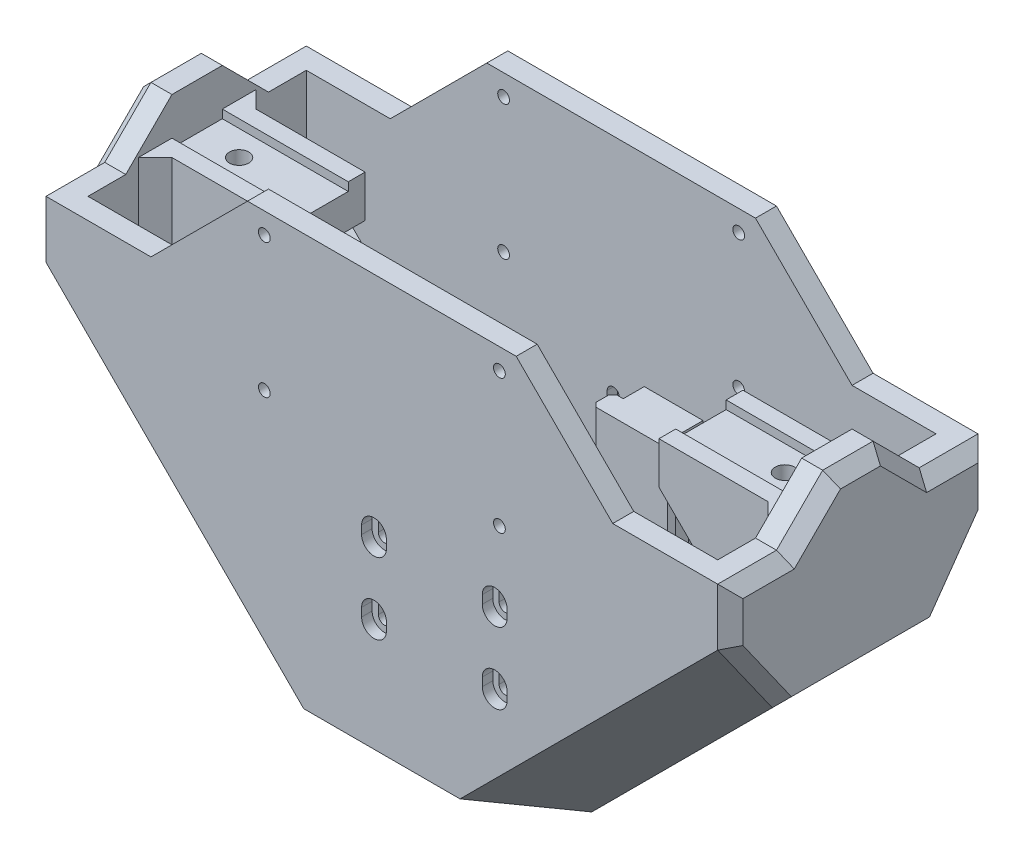
from build123d import *

# Parameters (mm, degrees)
SKETCH1_W                  = 150
SKETCH1_H                  = 52
BOSS_EXTRUDE1_DEPTH        = 70
SHELL1_T                   = 5
BOSS_EXTRUDE2_DEPTH        = 5
BOSS_EXTRUDE3_DEPTH        = 5
SKETCH3_R                  = 1.4
CUT_EXTRUDE1_DEPTH         = 6
BOSS_EXTRUDE4_DEPTH        = 10
SKETCH9_W                  = 30
SKETCH9_H                  = 20
BOSS_EXTRUDE6_DEPTH        = 2
CUT_EXTRUDE2_REACH         = 185.398
SKETCH10_W                 = 12
SKETCH10_H                 = 2
SKETCH11_R                 = 2.3
CUT_EXTRUDE3_DEPTH         = 6
CHAMFER3_SIZE              = 40
CHAMFER5_SIZE              = 43
CHAMFER11_SIZE             = 10
CHAMFER12_SIZE             = 13
CHAMFER13_SIZE             = 4
BOSS_EXTRUDE10_DEPTH       = 3
CHAMFER14_SIZE             = 3
CHAMFER14_OF_MIRROR28_SIZE = 3
SKETCH17_W                 = 14
SKETCH17_H                 = 5
BOSS_EXTRUDE11_DEPTH       = 45
SKETCH20_W                 = 19
SKETCH20_H                 = 5
BOSS_EXTRUDE14_DEPTH       = 8
CUT_EXTRUDE4_DEPTH         = 2.5
CUT_EXTRUDE5_REACH         = 140.124
CUT_EXTRUDE6_REACH         = 154.55
SKETCH24_W                 = 15
SKETCH24_H                 = 8
CHAMFER18_SIZE             = 4
CHAMFER19_SIZE             = 1
CHAMFER20_SIZE             = 2


# Some blends are built 0.0001 mm under size
with BuildPart() as part:
    # Sketch1 → Boss-Extrude1 (new body)
    with BuildSketch(Plane(origin=(0, 0, 0), x_dir=(1, 0, 0), z_dir=(0, 1, 0))):
        Rectangle(SKETCH1_W, SKETCH1_H)
    extrude(amount=BOSS_EXTRUDE1_DEPTH)

    # Shell1
    shell1_openings = [part.faces().sort_by_distance(p)[0] for p in [
        (0, 70, 0),
    ]]
    offset(amount=SHELL1_T, openings=shell1_openings, kind=Kind.INTERSECTION)

    # Sketch2 → Boss-Extrude2 (add)
    with BuildSketch(Plane(origin=(80, 0, 0), x_dir=(0, 0, -1), z_dir=(1, 0, 0))):
        Polygon((-17, 70), (-6, 81), (6, 81), (17, 70), align=None)
    boss_extrude2 = extrude(amount=-BOSS_EXTRUDE2_DEPTH)

    # Sketch4 → Boss-Extrude3 (add)
    with BuildSketch(Plane(origin=(0, 0, -31), x_dir=(-1, 0, 0), z_dir=(0, 0, -1))):
        Polygon((-55, 70), (-32, 93), (32, 93), (55, 70), align=None)
    boss_extrude3 = extrude(amount=-BOSS_EXTRUDE3_DEPTH)

    # Sketch3 → Cut-Extrude1 (cut)
    with BuildSketch(Plane(origin=(0, 0, -31), x_dir=(-1, 0, 0), z_dir=(0, 0, -1))):
        with Locations((-28, 88)):
            Circle(SKETCH3_R)
        with Locations((-28, 56)):
            Circle(SKETCH3_R)
        with Locations((28, 88)):
            Circle(SKETCH3_R)
        with Locations((28, 56)):
            Circle(SKETCH3_R)
    cut_extrude1 = extrude(amount=-CUT_EXTRUDE1_DEPTH, mode=Mode.SUBTRACT)

    # Mirror4: Boss-Extrude3, Cut-Extrude1 across plane
    add(boss_extrude3.mirror(Plane.XY))
    add(cut_extrude1.mirror(Plane.XY), mode=Mode.SUBTRACT)

    # Mirror5: Boss-Extrude2 across plane
    add(boss_extrude2.mirror(Plane(origin=(0, 0, 0), x_dir=(0, 0, 1), z_dir=(1, 0, 0))))

    # Sketch5 → Boss-Extrude4 (add, symmetric)
    with BuildSketch(Plane.XY):
        Polygon((-75, 70), (-45, 70), (-45, 62), (-75, 32), align=None)
    boss_extrude4 = extrude(amount=BOSS_EXTRUDE4_DEPTH, both=True)

    # Sketch9 → Boss-Extrude6 (add)
    with BuildSketch(Plane(origin=(0, 70, 0), x_dir=(1, 0, 0), z_dir=(0, 1, 0))):
        with Locations((-60, 0)):
            Rectangle(SKETCH9_W, SKETCH9_H)
    boss_extrude6 = extrude(amount=BOSS_EXTRUDE6_DEPTH)

    # Sketch10 → Cut-Extrude2 (cut, up to next)
    with BuildSketch(Plane(origin=(-75, 0, 0), x_dir=(0, 0, -1), z_dir=(1, 0, 0)), mode=Mode.PRIVATE) as cut_extrude2_sk1:
        with Locations((0, 71)):
            Rectangle(SKETCH10_W, SKETCH10_H)
    cut_extrude2_tool1 = extrude(cut_extrude2_sk1.sketch, amount=CUT_EXTRUDE2_REACH, mode=Mode.PRIVATE) & part.part
    cut_extrude2 = cut_extrude2_tool1.solids().sort_by_distance((-75, 71, 0))[0]
    add(cut_extrude2, mode=Mode.SUBTRACT)

    # Sketch11 → Cut-Extrude3 (cut)
    with BuildSketch(Plane(origin=(0, 70, 0), x_dir=(1, 0, 0), z_dir=(0, 1, 0))):
        with Locations(Location((-65, 0, 0), (0, 0, 270))):
            Circle(SKETCH11_R)
    cut_extrude3 = extrude(amount=-CUT_EXTRUDE3_DEPTH, mode=Mode.SUBTRACT)

    # Mirror24: Boss-Extrude4, Boss-Extrude6, Cut-Extrude2, Cut-Extrude3 across plane
    add(boss_extrude4.mirror(Plane(origin=(0, 0, 0), x_dir=(0, 0, 1), z_dir=(1, 0, 0))))
    add(boss_extrude6.mirror(Plane(origin=(0, 0, 0), x_dir=(0, 0, 1), z_dir=(1, 0, 0))))
    add(cut_extrude2.mirror(Plane(origin=(0, 0, 0), x_dir=(0, 0, 1), z_dir=(1, 0, 0))), mode=Mode.SUBTRACT)
    add(cut_extrude3.mirror(Plane(origin=(0, 0, 0), x_dir=(0, 0, 1), z_dir=(1, 0, 0))), mode=Mode.SUBTRACT)

    # Chamfer3
    # the kernel refuses this chamfer: 40 mm, written as the material it adds along each edge
    with BuildSketch(Plane(origin=(75, 0, 26), x_dir=(-0.9996219169112968, -0.027495876610586372, 0), z_dir=(0, 0, -1))) as chamfer3_piece_1:
        Polygon((CHAMFER3_SIZE * 0.999621916911, CHAMFER3_SIZE * 0.0274958766106), (-CHAMFER3_SIZE * 0.0274958766106, CHAMFER3_SIZE * 0.999621916911), (0, 0), align=None)
    extrude(amount=52)
    with BuildSketch(Plane(origin=(-75, 0, -26), x_dir=(-0.027495876610586317, 0.9996219169112968, 0), z_dir=(0, 0, 1))) as chamfer3_piece_2:
        Polygon((CHAMFER3_SIZE * 0.999621916911, -CHAMFER3_SIZE * 0.0274958766106), (-CHAMFER3_SIZE * 0.0274958766106, -CHAMFER3_SIZE * 0.999621916911), (0, 0), align=None)
    extrude(amount=52)

    # Chamfer5
    chamfer5_edges = [part.edges().sort_by_distance(p)[0] for p in [
        (-80, -5, 0),
        (80, -5, 0),
    ]]
    chamfer(chamfer5_edges, length=CHAMFER5_SIZE)

    # Chamfer11
    chamfer11_edges = [part.edges().sort_by_distance(p)[0] for p in [
        (-55, 20, -26),
        (55, 20, -26),
        (-55, 20, 26),
        (55, 20, 26),
    ]]
    chamfer(chamfer11_edges, length=CHAMFER11_SIZE)

    # Chamfer12
    chamfer12_edges = [part.edges().sort_by_distance(p)[0] for p in [
        (-58.5, 16.5, -31),
        (58.5, 16.5, -31),
        (-58.5, 16.5, 31),
        (58.5, 16.5, 31),
    ]]
    chamfer(chamfer12_edges, length=CHAMFER12_SIZE)

    # Chamfer13
    chamfer13_edges = [part.edges().sort_by_distance(p)[0] for p in [
        (-75, 56, -10),
        (-75, 56, 10),
        (75, 56, 10),
        (75, 56, -10),
    ]]
    chamfer(chamfer13_edges, length=CHAMFER13_SIZE)

    # Sketch16 → Boss-Extrude10 (add)
    with BuildSketch(Plane(origin=(80, 0, 0), x_dir=(0, 0, -1), z_dir=(1, 0, 0))):
        Polygon((-18, 38), (18, 38), (31, 56.384776311), (31, 70), (17, 70), (6, 81), (-6, 81), (-17, 70), (-31, 70), (-31, 56.384776311), align=None)
    boss_extrude10 = extrude(amount=BOSS_EXTRUDE10_DEPTH)

    # Chamfer14
    chamfer14_edges = [part.edges().sort_by_distance(p)[0] for p in [
        (83, 63.192388155, 31),
        (83, 70, 24),
        (83, 75.5, 11.5),
        (83, 81, 0),
        (83, 75.5, -11.5),
        (83, 70, -24),
        (83, 63.192388155, -31),
        (83, 47.192388155, -24.5),
        (83, 38, 0),
        (83, 47.192388155, 24.5),
    ]]
    chamfer(chamfer14_edges, length=CHAMFER14_SIZE - 0.0001)  # a hair under: the kernel refuses the full size

    # Mirror28: Boss-Extrude10 across plane
    add(boss_extrude10.mirror(Plane(origin=(0, 0, 0), x_dir=(0, 0, 1), z_dir=(1, 0, 0))))

    # Chamfer14 of Mirror28
    chamfer14_of_mirror28_edges = [part.edges().sort_by_distance(p)[0] for p in [
        (-83, 63.192388155, 31),
        (-83, 70, 24),
        (-83, 75.5, 11.5),
        (-83, 81, 0),
        (-83, 75.5, -11.5),
        (-83, 70, -24),
        (-83, 63.192388155, -31),
        (-83, 47.192388155, -24.5),
        (-83, 38, 0),
        (-83, 47.192388155, 24.5),
    ]]
    chamfer(chamfer14_of_mirror28_edges, length=CHAMFER14_OF_MIRROR28_SIZE - 0.0001)  # a hair under: the kernel refuses the full size

    # Sketch17 → Boss-Extrude11 (add)
    with BuildSketch(Plane(origin=(0, 0, 0), x_dir=(1, 0, 0), z_dir=(0, 1, 0))):
        Polygon((3, -21), (5.5, -21), (19.5, -21), (22, -21), (22, -16), (3, -16), align=None)
        with Locations((12.5, -23.5)):
            Rectangle(SKETCH17_W, SKETCH17_H)
    boss_extrude11 = extrude(amount=BOSS_EXTRUDE11_DEPTH)

    # Sketch20 → Boss-Extrude14 (add)
    with BuildSketch(Plane(origin=(0, 0, 0), x_dir=(1, 0, 0), z_dir=(0, 1, 0))):
        with Locations((12.5, -13.5)):
            Rectangle(SKETCH20_W, SKETCH20_H)
    boss_extrude14 = extrude(amount=BOSS_EXTRUDE14_DEPTH)

    # Mirror29: Boss-Extrude11, Boss-Extrude14 across plane
    add(boss_extrude11.mirror(Plane.XY))
    add(boss_extrude14.mirror(Plane.XY))

    # Sketch22 → Cut-Extrude4 (cut)
    with BuildSketch(Plane.XY.offset(-26)):
        with BuildLine():
            Line((-3.325, 37.8), (-3.325, 39.8))
            ThreePointArc((-3.325, 39.8), (-1.875, 41.25), (-0.425, 39.8))
            Line((-0.425, 39.8), (-0.425, 37.8))
            ThreePointArc((-0.425, 37.8), (-1.875, 36.35), (-3.325, 37.8))
        make_face()
        with BuildLine():
            Line((28.325, 37.8), (28.325, 39.8))
            ThreePointArc((28.325, 39.8), (26.875, 41.25), (25.425, 39.8))
            Line((25.425, 39.8), (25.425, 37.8))
            ThreePointArc((25.425, 37.8), (26.875, 36.35), (28.325, 37.8))
        make_face()
        with BuildLine():
            Line((-3.325, 22.8), (-3.325, 20.8))
            ThreePointArc((-3.325, 20.8), (-1.875, 19.35), (-0.425, 20.8))
            Line((-0.425, 20.8), (-0.425, 22.8))
            ThreePointArc((-0.425, 22.8), (-1.875, 24.25), (-3.325, 22.8))
        make_face()
        with BuildLine():
            Line((28.325, 22.8), (28.325, 20.8))
            ThreePointArc((28.325, 20.8), (26.875, 19.35), (25.425, 20.8))
            Line((25.425, 20.8), (25.425, 22.8))
            ThreePointArc((25.425, 22.8), (26.875, 24.25), (28.325, 22.8))
        make_face()
    cut_extrude4 = extrude(amount=-CUT_EXTRUDE4_DEPTH, mode=Mode.SUBTRACT)

    # Sketch23 → Cut-Extrude5 (cut, up to next)
    with BuildSketch(Plane.XY.offset(-28.5), mode=Mode.PRIVATE) as cut_extrude5_sk1:
        with BuildLine():
            Line((29.825, 37.8), (29.825, 39.8))
            ThreePointArc((29.825, 39.8), (26.875, 42.75), (23.925, 39.8))
            Line((23.925, 39.8), (23.925, 37.8))
            ThreePointArc((23.925, 37.8), (26.875, 34.85), (29.825, 37.8))
        make_face()
    cut_extrude5_tool1 = extrude(cut_extrude5_sk1.sketch, amount=-CUT_EXTRUDE5_REACH, mode=Mode.PRIVATE) & part.part
    # Sketch23 → Cut-Extrude5 (cut, up to next)
    with BuildSketch(Plane.XY.offset(-28.5), mode=Mode.PRIVATE) as cut_extrude5_sk2:
        with BuildLine():
            Line((1.075, 37.8), (1.075, 39.8))
            ThreePointArc((1.075, 39.8), (-1.875, 42.75), (-4.825, 39.8))
            Line((-4.825, 39.8), (-4.825, 37.8))
            ThreePointArc((-4.825, 37.8), (-1.875, 34.85), (1.075, 37.8))
        make_face()
    cut_extrude5_tool2 = extrude(cut_extrude5_sk2.sketch, amount=-CUT_EXTRUDE5_REACH, mode=Mode.PRIVATE) & part.part
    # Sketch23 → Cut-Extrude5 (cut, up to next)
    with BuildSketch(Plane.XY.offset(-28.5), mode=Mode.PRIVATE) as cut_extrude5_sk3:
        with BuildLine():
            Line((-4.825, 22.8), (-4.825, 20.8))
            ThreePointArc((-4.825, 20.8), (-1.875, 17.85), (1.075, 20.8))
            Line((1.075, 20.8), (1.075, 22.8))
            ThreePointArc((1.075, 22.8), (-1.875, 25.75), (-4.825, 22.8))
        make_face()
    cut_extrude5_tool3 = extrude(cut_extrude5_sk3.sketch, amount=-CUT_EXTRUDE5_REACH, mode=Mode.PRIVATE) & part.part
    # Sketch23 → Cut-Extrude5 (cut, up to next)
    with BuildSketch(Plane.XY.offset(-28.5), mode=Mode.PRIVATE) as cut_extrude5_sk4:
        with BuildLine():
            Line((23.925, 22.8), (23.925, 20.8))
            ThreePointArc((23.925, 20.8), (26.875, 17.85), (29.825, 20.8))
            Line((29.825, 20.8), (29.825, 22.8))
            ThreePointArc((29.825, 22.8), (26.875, 25.75), (23.925, 22.8))
        make_face()
    cut_extrude5_tool4 = extrude(cut_extrude5_sk4.sketch, amount=-CUT_EXTRUDE5_REACH, mode=Mode.PRIVATE) & part.part
    cut_extrude5_1 = cut_extrude5_tool1.solids().sort_by_distance((26.875, 38.8, -28.5))[0]
    add(cut_extrude5_1, mode=Mode.SUBTRACT)
    cut_extrude5_2 = cut_extrude5_tool2.solids().sort_by_distance((-1.875, 38.8, -28.5))[0]
    add(cut_extrude5_2, mode=Mode.SUBTRACT)
    cut_extrude5_3 = cut_extrude5_tool3.solids().sort_by_distance((-1.875, 21.8, -28.5))[0]
    add(cut_extrude5_3, mode=Mode.SUBTRACT)
    cut_extrude5_4 = cut_extrude5_tool4.solids().sort_by_distance((26.875, 21.8, -28.5))[0]
    add(cut_extrude5_4, mode=Mode.SUBTRACT)
    cut_extrude5 = cut_extrude5_1 + cut_extrude5_2 + cut_extrude5_3 + cut_extrude5_4  # Cut-Extrude5 as one shape, for the pattern or mirror that repeats it

    # Mirror30: Cut-Extrude4, Cut-Extrude5 across plane
    add(cut_extrude4.mirror(Plane.XY), mode=Mode.SUBTRACT)
    add(cut_extrude5.mirror(Plane.XY), mode=Mode.SUBTRACT)

    # Sketch24 → Cut-Extrude6 (cut, up to next)
    with BuildSketch(Plane(origin=(17.5, -17.5, 0), x_dir=(0, 0, 1), z_dir=(-0.707106781186544, 0.7071067811865511, 0)), mode=Mode.PRIVATE) as cut_extrude6_sk1:
        with Locations((0, 33.748737342)):
            Rectangle(SKETCH24_W, SKETCH24_H)
    cut_extrude6_tool1 = extrude(cut_extrude6_sk1.sketch, amount=-CUT_EXTRUDE6_REACH, mode=Mode.PRIVATE) & part.part
    add(cut_extrude6_tool1.solids().sort_by_distance((41.363961, 6.363961, 0))[0], mode=Mode.SUBTRACT)

    # Chamfer18
    chamfer18_edges = [part.edges().sort_by_distance(p)[0] for p in [
        (22, 0, 16),
        (3, 0, 16),
        (3, 0, -16),
        (22, 0, -16),
    ]]
    chamfer(chamfer18_edges, length=CHAMFER18_SIZE)

    # Chamfer19
    chamfer19_edges = [part.edges().sort_by_distance(p)[0] for p in [
        (3, 24.5, 21),
        (22, 24.5, 21),
        (22, 26.5, 16),
        (3, 26.5, 16),
        (3, 24.5, -21),
        (3, 26.5, -16),
        (22, 26.5, -16),
        (22, 24.5, -21),
    ]]
    chamfer(chamfer19_edges, length=CHAMFER19_SIZE)

    # Chamfer20
    chamfer20_edges = [part.edges().sort_by_distance(p)[0] for p in [
        (45.942388155, 7.442388155, 7.5),
        (40.285533906, 1.785533906, 7.5),
        (40.285533906, 1.785533906, -7.5),
        (45.942388155, 7.442388155, -7.5),
    ]]
    chamfer(chamfer20_edges, length=CHAMFER20_SIZE)


solid = part.part
